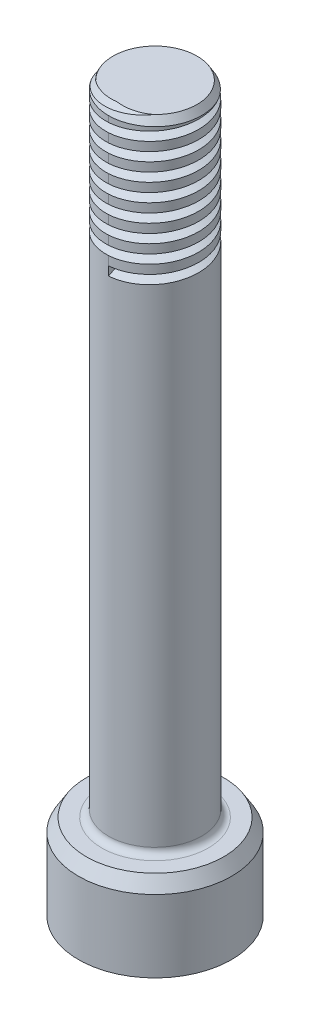
from build123d import *

# Parameters (mm, degrees)
CUT_SWEEP1_PITCH   = 0.793751588
CUT_EXTRUDE1_DEPTH = 1.955803912
FILLET1_R          = 0.30480061
FILLET2_R          = 0.396875794
CHAMFER3_SIZE      = 0.127


with BuildPart() as part:
    # Sketch1 → Revolve1 (revolve)
    with BuildSketch(Plane.XY, mode=Mode.PRIVATE) as revolve1_sk:
        Polygon((0, 0), (0, 32.740608331), (2.082804166, 32.740608331), (2.082804166, 4.165608331), (3.429006858, 4.165608331), (3.429006858, 0), align=None)
    revolve(revolve1_sk.sketch.rotate(Axis((0, 0, 0), (0, 1, 0)), 90), axis=Axis((0, 0, 0), (0, 1, 0)))

    # Cut-Sweep1: arcs per turn and ends read off the stored shape
    # Cut-Sweep1: the profile of Sketch3 profile screwed along a right-hand helix through 9 turns, 8 arcs to a turn; built about Z, then put on its axis
    cut_sweep1_z = Axis((0, 0, 0), (0, 0, 1))
    cut_sweep1_corners = [(2.083104166, 0, -0.595163691), (2.083104166, 0, -0.992339484), (1.685928372, 0, -0.793751588)]
    with BuildLine(mode=Mode.PRIVATE) as cut_sweep1_profile:
        Line(cut_sweep1_corners[0], cut_sweep1_corners[1])
        Line(cut_sweep1_corners[1], cut_sweep1_corners[2])
        Line(cut_sweep1_corners[2], cut_sweep1_corners[0])
    cut_sweep1_cap = Face(cut_sweep1_profile.wire())
    cut_sweep1_turn_angles = [0, 22.5, 45, 67.5, 90, 112.5, 135, 157.5, 180, 202.5, 225, 247.5, 270, 292.5, 315, 337.5, 360]
    cut_sweep1_turn_weights = [1, 0.9238795325112867, 1, 0.9238795325112867, 1, 0.9238795325112867, 1, 0.9238795325112867, 1, 0.9238795325112867, 1, 0.9238795325112867, 1, 0.9238795325112867, 1, 0.9238795325112867, 1]
    cut_sweep1_turn_rails = [Edge.make_bspline([Vector(p[0], p[1], 0).rotate(cut_sweep1_z, cut_sweep1_turn_angles[k]) / cut_sweep1_turn_weights[k] + Vector(0, 0, p[2] + CUT_SWEEP1_PITCH * cut_sweep1_turn_angles[k] / 360) for k in range(17)], [0, 0, 0, 1, 1, 2, 2, 3, 3, 4, 4, 5, 5, 6, 6, 7, 7, 8, 8, 8], 2, cut_sweep1_turn_weights) for p in cut_sweep1_corners]
    cut_sweep1_turn_sides = [Face.make_surface_from_curves(cut_sweep1_turn_rails[p[0]], cut_sweep1_turn_rails[p[1]]) for p in [(0, 1), (1, 2), (2, 0)]]
    cut_sweep1 = Plane(origin=(0, 32.740608331, 0), x_dir=(0, 0, 1), z_dir=(0, -1, 0)) * Solid(Shell([*[p.moved(Location((0, 0, CUT_SWEEP1_PITCH * i))) for i in range(9) for p in cut_sweep1_turn_sides], cut_sweep1_cap, cut_sweep1_cap.rotate(cut_sweep1_z, 3240).moved(Location((0, 0, CUT_SWEEP1_PITCH * 3240 / 360)))]))
    add(cut_sweep1, mode=Mode.SUBTRACT)

    # Sketch4 → Cut-Extrude1 (cut)
    with BuildSketch(Plane(origin=(0, 0, 0), x_dir=(1, 0, 0), z_dir=(0, 1, 0))):
        Polygon((0, 2.06772639), (-1.790703581, 1.033863195), (-1.790703581, -1.033863195), (0, -2.06772639), (1.790703581, -1.033863195), (1.790703581, 1.033863195), align=None)
    extrude(amount=CUT_EXTRUDE1_DEPTH, mode=Mode.SUBTRACT)

    # Fillet1
    fillet1_edges = [part.edges().sort_by_distance(p)[0] for p in [
        (0, 4.165608331, 2.082804166),
    ]]
    fillet(fillet1_edges, radius=FILLET1_R)

    # Fillet2
    fillet2_edges = [part.edges().sort_by_distance(p)[0] for p in [
        (1.790703581, 0.977901956, -1.033863195),
        (0, 0.977901956, -2.06772639),
        (-1.790703581, 0.977901956, -1.033863195),
        (-1.790703581, 0.977901956, 1.033863195),
        (0, 0.977901956, 2.06772639),
        (1.790703581, 0.977901956, 1.033863195),
        (0.895351791, 1.955803912, -1.550794792),
        (-0.895351791, 1.955803912, -1.550794792),
        (-1.790703581, 1.955803912, 0),
        (-0.895351791, 1.955803912, 1.550794792),
        (0.895351791, 1.955803912, 1.550794792),
        (1.790703581, 1.955803912, 0),
    ]]
    fillet(fillet2_edges, radius=FILLET2_R)

    # Chamfer1: read off the stored shape, not the designer's step
    # Chamfer1 outline → Chamfer1 (revolve, cut)
    with BuildSketch(Plane.XY):
        Polygon((2.082804166, 32.740608331), (1.879603759, 32.740608331), (2.082804166, 32.411469354), align=None)
    revolve(axis=Axis((0, 0, 0), (0, 1, 0)), mode=Mode.SUBTRACT)

    # Chamfer2: read off the stored shape, not the designer's step
    # Chamfer2 outline → Chamfer2 (revolve, cut)
    with BuildSketch(Plane.XY):
        Polygon((2.853013648, 0), (3.429006858, 0), (3.429006858, 0.355600711), align=None)
        Polygon((3.073406147, 4.165608331), (3.429006858, 3.589615121), (3.429006858, 4.165608331), align=None)
    revolve(axis=Axis((0, 0, 0), (0, 1, 0)), mode=Mode.SUBTRACT)

    # Chamfer3
    chamfer3_edges = [part.edges().sort_by_distance(p)[0] for p in [
        (0.895351791, 0, -1.550794792),
        (-0.895351791, 0, -1.550794792),
        (-1.790703581, 0, 0),
        (-0.895351791, 0, 1.550794792),
        (0.895351791, 0, 1.550794792),
        (1.790703581, 0, 0),
        (0, 0, -2.006329491),
        (1.737532307, 0, -1.003164745),
        (1.737532307, 0, 1.003164745),
        (0, 0, 2.006329491),
        (-1.737532307, 0, 1.003164745),
        (-1.737532307, 0, -1.003164745),
    ]]
    chamfer(chamfer3_edges, length=CHAMFER3_SIZE)


solid = part.part
